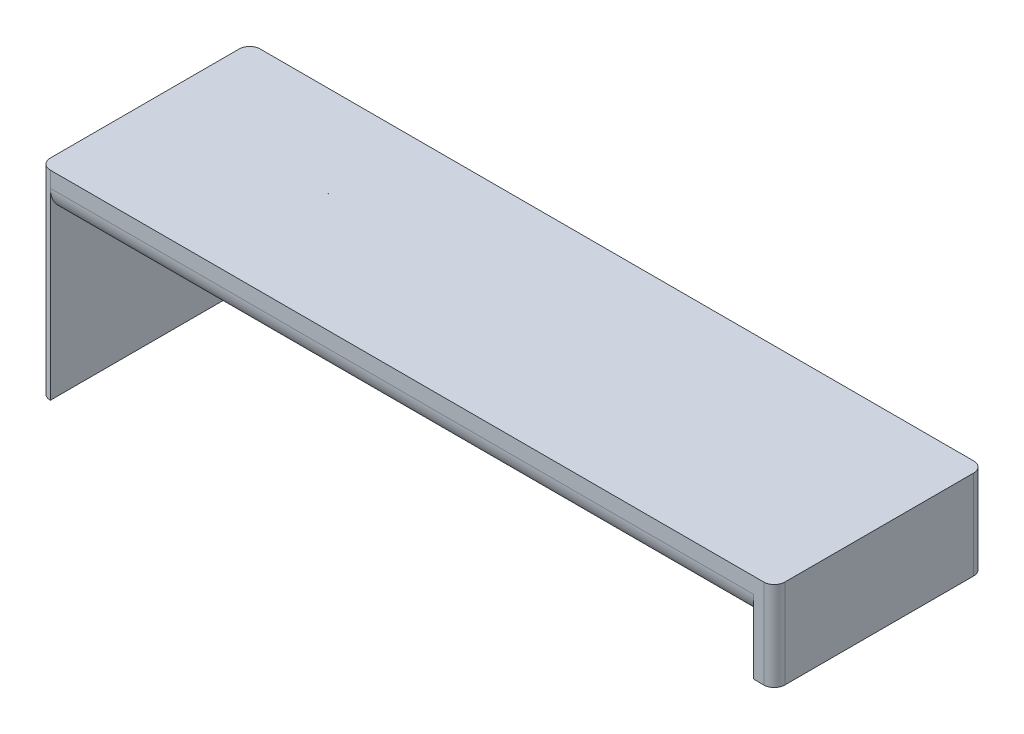
from build123d import *
from build123d.topology import SkipClean

# Parameters (mm, degrees)
SKETCH1_W           = 136
SKETCH1_H           = 40
SKETCH1_W_2         = 2
BOSS_EXTRUDE1_DEPTH = 8
SKETCH1_3_W         = 2
SKETCH1_3_H         = 40
BOSS_EXTRUDE2_DEPTH = 9
SKETCH2_W           = 10.875
SKETCH2_H           = 9
BOSS_EXTRUDE3_DEPTH = 1
BOSS_EXTRUDE4_START = 1
SKETCH2_3_W         = 10.875
SKETCH2_3_H         = 9
SKETCH2_3_W_2       = 17.05
SKETCH2_3_H_2       = 0.6
BOSS_EXTRUDE4_DEPTH = 1
SKETCH1_4_W         = 2
SKETCH1_4_H         = 40
BOSS_EXTRUDE5_DEPTH = 30
SKETCH3_R           = 12.1
CUT_EXTRUDE1_DEPTH  = 132
FILLET1_R           = 5
FILLET2_START       = -31
FILLET2_DEPTH       = 40
BOSS_EXTRUDE6_START = -2
BOSS_EXTRUDE6_DEPTH = 134
FILLET3_R           = 0.5
FILLET5_R           = 1


with BuildPart() as part:
    # Sketch1 → Boss-Extrude1 (new body)
    with BuildSketch(Plane(origin=(0, 0, 0), x_dir=(1, 0, 0), z_dir=(0, 1, 0))):
        Rectangle(SKETCH1_W, SKETCH1_H)
        with Locations((69, 0)):
            Rectangle(SKETCH1_W_2, SKETCH1_H)
        with Locations((-69, 0)):
            Rectangle(SKETCH1_W_2, SKETCH1_H)
    extrude(amount=BOSS_EXTRUDE1_DEPTH)

    # Sketch1<3> → Boss-Extrude2 (add)
    with BuildSketch(Plane(origin=(0, 0, 0), x_dir=(1, 0, 0), z_dir=(0, 1, 0))):
        with Locations((69, 0)):
            Rectangle(SKETCH1_3_W, SKETCH1_3_H)
    extrude(amount=-BOSS_EXTRUDE2_DEPTH)

    # Sketch2 → Boss-Extrude3 (add)
    with BuildSketch(Plane.ZY.offset(-68)):
        with Locations((14.5625, -4.5)):
            Rectangle(SKETCH2_W, SKETCH2_H)
        with Locations((-14.5625, -4.5)):
            Rectangle(SKETCH2_W, SKETCH2_H)
    extrude(amount=BOSS_EXTRUDE3_DEPTH)

    # Sketch2<3> → Boss-Extrude4 (add)
    with BuildSketch(Plane.ZY.offset(-68).offset(BOSS_EXTRUDE4_START)):
        Polygon((9.125, -9), (9.125, 0), (8.525, 0), (8.525, -0.6), (8.525, -9), align=None)
        with Locations((14.5625, -4.5)):
            Rectangle(SKETCH2_3_W, SKETCH2_3_H)
        with Locations((0, -0.3)):
            Rectangle(SKETCH2_3_W_2, SKETCH2_3_H_2)
        Polygon((-8.525, -0.6), (-8.525, 0), (-9.125, 0), (-9.125, -9), (-8.525, -9), align=None)
        with Locations((-14.5625, -4.5)):
            Rectangle(SKETCH2_3_W, SKETCH2_3_H)
    extrude(amount=BOSS_EXTRUDE4_DEPTH)

    # Sketch1<4> → Boss-Extrude5 (add)
    with BuildSketch(Plane(origin=(0, 0, 0), x_dir=(1, 0, 0), z_dir=(0, 1, 0))):
        with Locations((-69, 0)):
            Rectangle(SKETCH1_4_W, SKETCH1_4_H)
    extrude(amount=-BOSS_EXTRUDE5_DEPTH)

    # Sketch3 → Cut-Extrude1 (cut)
    with BuildSketch(Plane.ZY.offset(-64)):
        with Locations((0, -6.5)):
            Circle(SKETCH3_R)
    extrude(amount=CUT_EXTRUDE1_DEPTH, mode=Mode.SUBTRACT)

    # Fillet1
    fillet1_edges = [part.edges().sort_by_distance(p)[0] for p in [
        (-1, 0, -20),
        (-1, 0, 20),
    ]]
    fillet(fillet1_edges, radius=FILLET1_R)

    # Fillet2: read off the stored shape, not the designer's step
    # Fillet2 outline → Fillet2 (cut)
    with BuildSketch(Plane(origin=(0, 0, 0), x_dir=(1, 0, 0), z_dir=(0, 1, 0)).offset(FILLET2_START)):
        with BuildLine():
            Line((-70, -20), (-68, -20))
            ThreePointArc((-68, -20), (-69.414213562, -19.414213562), (-70, -18))
            Line((-70, -18), (-70, -20))
        make_face()
        with BuildLine():
            ThreePointArc((70, -18), (69.414213562, -19.414213562), (68, -20))
            Line((68, -20), (70, -20))
            Line((70, -20), (70, -18))
        make_face()
        with BuildLine():
            Line((-70, 20), (-70, 18))
            ThreePointArc((-70, 18), (-69.414213562, 19.414213562), (-68, 20))
            Line((-68, 20), (-70, 20))
        make_face()
        with BuildLine():
            ThreePointArc((68, 20), (69.414213562, 19.414213562), (70, 18))
            Line((70, 18), (70, 20))
            Line((70, 20), (68, 20))
        make_face()
    extrude(amount=FILLET2_DEPTH, mode=Mode.SUBTRACT)

    # Sketch3<3> → Boss-Extrude6 (add)
    with SkipClean():  # the faces are left unmerged after this step: merging them gives an invalid solid
        with BuildSketch(Plane.ZY.offset(-64).offset(BOSS_EXTRUDE6_START)):
            with BuildLine():
                Line((-11.655363572, 0), (-11.655363572, -3.25))
                ThreePointArc((-11.655363572, -3.25), (-11.050752229, -1.571422601), (-10.205880658, 0))
                Line((-10.205880658, 0), (-11.655363572, 0))
            make_face()
            with BuildLine():
                ThreePointArc((10.205880658, 0), (11.050752229, -1.571422601), (11.655363572, -3.25))
                Line((11.655363572, -3.25), (11.655363572, 0))
                Line((11.655363572, 0), (10.205880658, 0))
            make_face()
        extrude(amount=BOSS_EXTRUDE6_DEPTH)

    # Fillet3
    fillet3_edges = [part.edges().sort_by_distance(p)[0] for p in [
        (-1, -3.25, -11.655363572),
        (-1, -3.25, 11.655363572),
    ]]
    fillet(fillet3_edges, radius=FILLET3_R)

    # Fillet5
    # the kernel refuses this fillet: 1 mm, written as the material it takes off along each edge
    with BuildSketch(Plane(origin=(64, 0, -12.705880658), x_dir=(1, 0, 0), z_dir=(0, 0, 1))) as fillet5_piece_1_section:
        with BuildLine():
            CenterArc((FILLET5_R, FILLET5_R), FILLET5_R, 180, 90)
            Line((0, FILLET5_R), (0, 0))
            Line((0, 0), (FILLET5_R, 0))
        make_face()
    fillet5_piece_1 = extrude(amount=25.411761315, mode=Mode.PRIVATE)
    fillet5_piece_1 = fillet5_piece_1 & Plane(origin=(64, -6.5, 0), x_dir=(0, 0.5371900826446553, 0.8434612113833264), z_dir=(1, 0, 0)) * Cylinder(12.1, 55, mode=Mode.PRIVATE)
    add(fillet5_piece_1, mode=Mode.SUBTRACT)


solid = part.part
